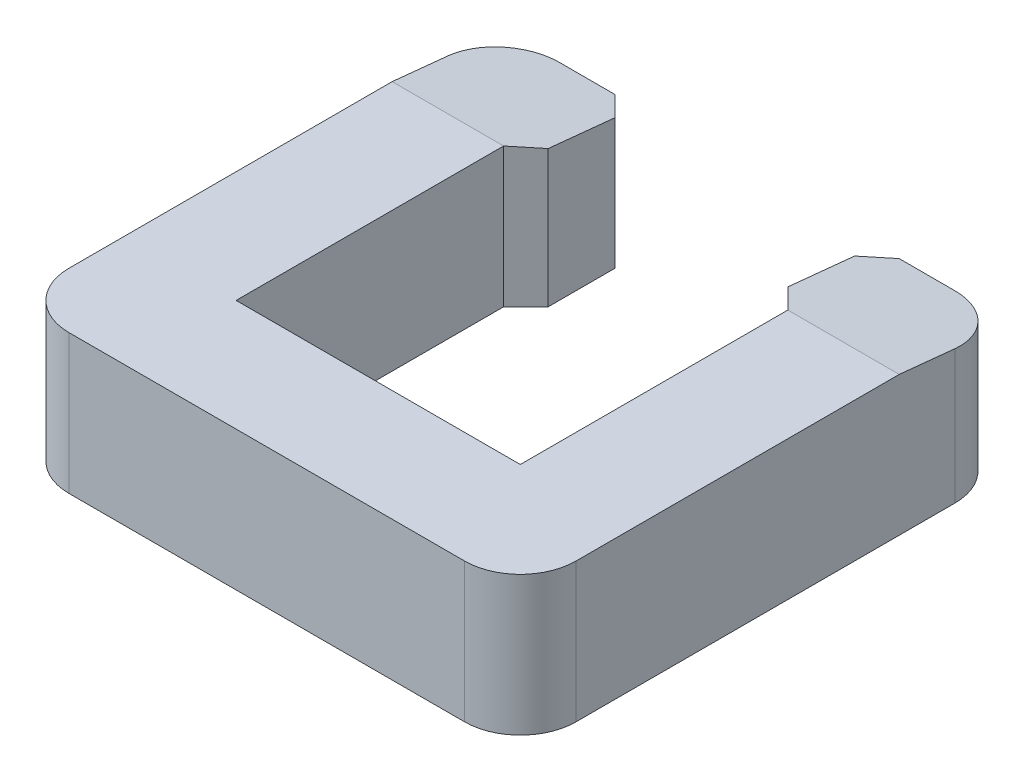
from build123d import *

# Parameters (mm, degrees)
BOSS_EXTRUDE1_DEPTH = 3.175
FILLET1_R           = 1.27
CUT_EXTRUDE1_DEPTH  = 14.223865471


with BuildPart() as part:
    # Sketch1 → Boss-Extrude1 (new body)
    with BuildSketch(Plane(origin=(0, 0, 0), x_dir=(1, 0, 0), z_dir=(0, 1, 0))):
        Polygon((-5.7785, 5.588), (-5.7785, -5.588), (5.7785, -5.588), (5.7785, 5.588), (3.2385, 5.588), (2.7305, 5.08), (2.7305, 3.556), (3.2385, 3.048), (3.2385, -3.048), (-3.2385, -3.048), (-3.2385, 3.048), (-2.7305, 3.556), (-2.7305, 5.08), (-3.2385, 5.588), align=None)
    extrude(amount=BOSS_EXTRUDE1_DEPTH)

    # Fillet1
    fillet1_edges = [part.edges().sort_by_distance(p)[0] for p in [
        (-5.7785, 1.5875, -5.588),
        (5.7785, 1.5875, -5.588),
        (5.7785, 1.5875, 5.588),
        (-5.7785, 1.5875, 5.588),
    ]]
    fillet(fillet1_edges, radius=FILLET1_R)

    # Sketch2 → Cut-Extrude1 (cut, through all)
    with BuildSketch(Plane(origin=(5.7785, 0, 0), x_dir=(0, 0, -1), z_dir=(1, 0, 0))):
        Polygon((5.588, 3.175), (3.048, 3.175), (5.588, 2.921), align=None)
    extrude(amount=-CUT_EXTRUDE1_DEPTH, mode=Mode.SUBTRACT)


solid = part.part
